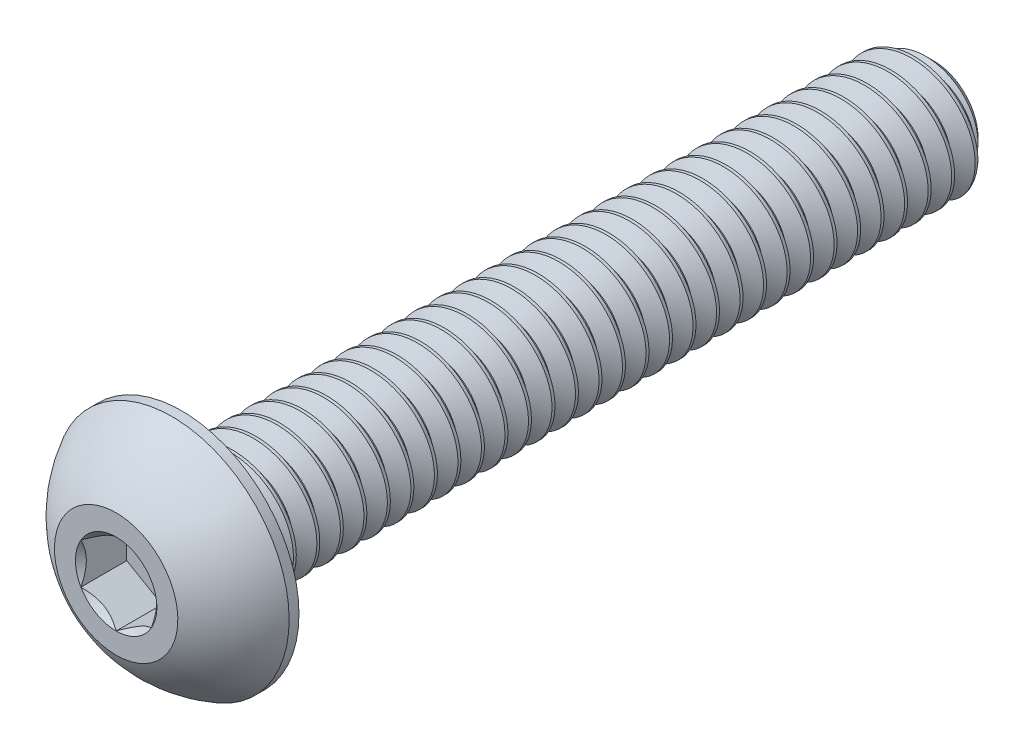
from build123d import *

# Parameters (mm, degrees)
SKETCH1_W          = 25.4
SKETCH1_H          = 2.0828
CHAMFER1_SIZE      = 0.5953125
CUT_SWEEP1_PITCH   = 0.79375
CUT_EXTRUDE2_DEPTH = 1.54686


with BuildPart() as part:
    # Sketch1 → Revolve1 (revolve)
    with BuildSketch(Plane(origin=(0, 0, 0), x_dir=(0, 0, -1), z_dir=(1, 0, 0))):
        with Locations((14.9098, 1.0414)):
            Rectangle(SKETCH1_W, SKETCH1_H)
    revolve(axis=Axis((0, 0, -27.6098), (0, 0, 1)))

    # Chamfer1
    chamfer1_edges = [part.edges().sort_by_distance(p)[0] for p in [
        (0, -2.0828, -27.6098),
    ]]
    chamfer(chamfer1_edges, length=CHAMFER1_SIZE)

    # Cut-Sweep1: arcs per turn and ends read off the stored shape
    # Cut-Sweep1: the profile of Sketch2 profile screwed along a right-hand helix through 34.784 turns, 8 arcs to a turn; built about Z, then put on its axis
    cut_sweep1_z = Axis((0, 0, 0), (0, 0, 1))
    cut_sweep1_corners = [(2.0831, 0, 0.000173205), (2.0831, 0, -0.694704455), (1.567244252, 0, -0.396875), (1.567244252, 0, -0.29765625)]
    with BuildLine(mode=Mode.PRIVATE) as cut_sweep1_profile:
        Line(cut_sweep1_corners[0], cut_sweep1_corners[1])
        Line(cut_sweep1_corners[1], cut_sweep1_corners[2])
        Line(cut_sweep1_corners[2], cut_sweep1_corners[3])
        Line(cut_sweep1_corners[3], cut_sweep1_corners[0])
    cut_sweep1_cap = Face(cut_sweep1_profile.wire())
    cut_sweep1_turn_angles = [0, 22.5, 45, 67.5, 90, 112.5, 135, 157.5, 180, 202.5, 225, 247.5, 270, 292.5, 315, 337.5, 360]
    cut_sweep1_turn_weights = [1, 0.9238795325112867, 1, 0.9238795325112867, 1, 0.9238795325112867, 1, 0.9238795325112867, 1, 0.9238795325112867, 1, 0.9238795325112867, 1, 0.9238795325112867, 1, 0.9238795325112867, 1]
    cut_sweep1_turn_rails = [Edge.make_bspline([Vector(p[0], p[1], 0).rotate(cut_sweep1_z, cut_sweep1_turn_angles[k]) / cut_sweep1_turn_weights[k] + Vector(0, 0, p[2] + CUT_SWEEP1_PITCH * cut_sweep1_turn_angles[k] / 360) for k in range(17)], [0, 0, 0, 1, 1, 2, 2, 3, 3, 4, 4, 5, 5, 6, 6, 7, 7, 8, 8, 8], 2, cut_sweep1_turn_weights) for p in cut_sweep1_corners]
    cut_sweep1_turn_sides = [Face.make_surface_from_curves(cut_sweep1_turn_rails[p[0]], cut_sweep1_turn_rails[p[1]]) for p in [(0, 1), (1, 2), (2, 3), (3, 0)]]
    cut_sweep1_last_angles = [12240, 12262.5, 12285, 12307.5, 12330, 12352.5, 12375, 12397.5, 12420, 12442.5, 12465, 12487.5, 12510, 12516.12, 12522.24]
    cut_sweep1_last_weights = [1, 0.9238795325112867, 1, 0.9238795325112867, 1, 0.9238795325112867, 1, 0.9238795325112867, 1, 0.9238795325112867, 1, 0.9238795325112867, 1, 0.9943007903969737, 1]
    cut_sweep1_last_rails = [Edge.make_bspline([Vector(p[0], p[1], 0).rotate(cut_sweep1_z, cut_sweep1_last_angles[k]) / cut_sweep1_last_weights[k] + Vector(0, 0, p[2] + CUT_SWEEP1_PITCH * cut_sweep1_last_angles[k] / 360) for k in range(15)], [0, 0, 0, 1, 1, 2, 2, 3, 3, 4, 4, 5, 5, 6, 6, 7, 7, 7], 2, cut_sweep1_last_weights) for p in cut_sweep1_corners]
    cut_sweep1_last_sides = [Face.make_surface_from_curves(cut_sweep1_last_rails[p[0]], cut_sweep1_last_rails[p[1]]) for p in [(0, 1), (1, 2), (2, 3), (3, 0)]]
    cut_sweep1 = Plane(origin=(0, 0, -27.6098), x_dir=(0, 1, 0), z_dir=(0, 0, 1)) * Solid(Shell([*[p.moved(Location((0, 0, CUT_SWEEP1_PITCH * i))) for i in range(34) for p in cut_sweep1_turn_sides], *cut_sweep1_last_sides, cut_sweep1_cap, cut_sweep1_cap.rotate(cut_sweep1_z, 12522.24).moved(Location((0, 0, CUT_SWEEP1_PITCH * 12522.24 / 360)))]))
    add(cut_sweep1, mode=Mode.SUBTRACT)

    # Sketch7 → Revolve2 (revolve)
    with BuildSketch(Plane(origin=(0, 0, 0), x_dir=(0, 0, -1), z_dir=(1, 0, 0)), mode=Mode.PRIVATE) as revolve2_sk:
        with BuildLine():
            Line((1.87833, 3.9624), (2.2098, 3.9624))
            Line((2.2098, 3.9624), (2.2098, 0))
            Line((2.2098, 0), (0, 0))
            Line((0, 0), (0, 2.0828))
            ThreePointArc((0, 2.0828), (0.796523813, 3.165144808), (1.87833, 3.9624))
        make_face()
    revolve(revolve2_sk.sketch.rotate(Axis((0, 0, 0), (0, 0, -1)), 189.052465709), axis=Axis((0, 0, 0), (0, 0, -1)))

    # Sketch5 → Cut-Extrude2 (cut)
    with BuildSketch(Plane.XY):
        Polygon((1.190625, -0.687407664), (1.190625, 0.687407664), (0, 1.374815329), (-1.190625, 0.687407664), (-1.190625, -0.687407664), (0, -1.374815329), align=None)
    extrude(amount=-CUT_EXTRUDE2_DEPTH, mode=Mode.SUBTRACT)

    # Cut-Extrude3 cone 1 section (through the dimple's axis) → Cut-Extrude3 (revolve, cut)
    with BuildSketch(Plane(origin=(0, 0, 0), x_dir=(0, -1, 0), z_dir=(1, 0, 0))):
        Polygon((0, 0), (1.374815329, 0), (0, 1.374815329), align=None)
    revolve(axis=Axis((0, 0, 0), (0, 0, -1)), mode=Mode.SUBTRACT)


solid = part.part
